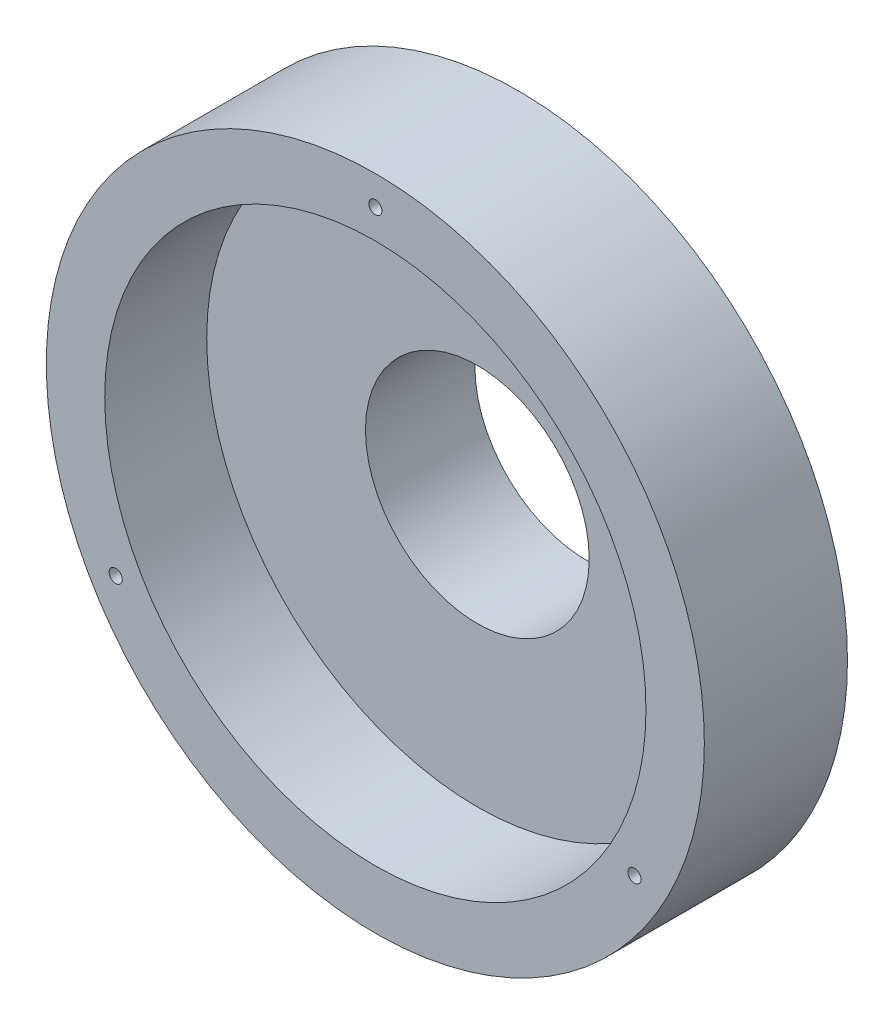
from build123d import *

# Parameters (mm, degrees)
SKETCH1_R                 = 24
BOSS_EXTRUDE1_DEPTH       = 3.8
SKETCH2_R                 = 18.7
BOSS_EXTRUDE2_DEPTH       = 4.5
SKETCH3_R                 = 1
CUT_EXTRUDE1_DEPTH        = 4.5
SKETCH4_R                 = 13.6
CUT_EXTRUDE2_DEPTH        = 35.941236383
SKETCH5_R                 = 40
BOSS_EXTRUDE3_DEPTH       = 17.4
SKETCH6_R                 = 32.9
CUT_EXTRUDE6_DEPTH        = 12.4
CUT_EXTRUDE7_START        = -12.4
SKETCH7_R                 = 13.6
CUT_EXTRUDE7_DEPTH        = 12.4
M2X0_4_TAPPED_HOLE1_D     = 1.6
M2X0_4_TAPPED_HOLE1_DEPTH = 5
M2X0_4_TAPPED_HOLE1_TIP   = 0.480688495


with BuildPart() as part:
    # Sketch1 → Boss-Extrude1 (new body)
    with BuildSketch(Plane.XY):
        Circle(SKETCH1_R)
    extrude(amount=BOSS_EXTRUDE1_DEPTH)

    # Sketch2 → Boss-Extrude2 (add)
    with BuildSketch(Plane.XY.offset(3.8)):
        Circle(SKETCH2_R)
    extrude(amount=BOSS_EXTRUDE2_DEPTH)

    # Sketch3 → Cut-Extrude1 (cut)
    with BuildSketch(Plane.XY.offset(3.8)):
        with Locations((0, 22.2)):
            Circle(SKETCH3_R)
    extrude(amount=-CUT_EXTRUDE1_DEPTH, mode=Mode.SUBTRACT)

    # Sketch4 → Cut-Extrude2 (cut, through all)
    with BuildSketch(Plane.XY.offset(8.3)):
        Circle(SKETCH4_R)
    extrude(amount=-CUT_EXTRUDE2_DEPTH, mode=Mode.SUBTRACT)

    # Sketch5 → Boss-Extrude3 (add)
    with BuildSketch(Plane.XY.offset(8.3)):
        Circle(SKETCH5_R)
    extrude(amount=BOSS_EXTRUDE3_DEPTH)

    # Sketch6 → Cut-Extrude6 (cut)
    with BuildSketch(Plane.XY.offset(25.7)):
        Circle(SKETCH6_R)
    extrude(amount=-CUT_EXTRUDE6_DEPTH, mode=Mode.SUBTRACT)

    # Sketch7 → Cut-Extrude7 (cut)
    with BuildSketch(Plane(origin=(0, 0, 8.3), x_dir=(-1, 0, 0), z_dir=(0, 0, -1)).offset(CUT_EXTRUDE7_START)):
        Circle(SKETCH7_R)
    extrude(amount=CUT_EXTRUDE7_DEPTH, mode=Mode.SUBTRACT)

    # M2x0.4 Tapped Hole1
    with Locations(Plane(origin=(0, 36.45, 25.7), x_dir=(1, 0, 0), z_dir=(0, 0, 1))):
        with Locations((0, 0), (-31.566625968, -54.6), (31.501674063, -54.6375)):
            Hole(M2X0_4_TAPPED_HOLE1_D / 2, depth=M2X0_4_TAPPED_HOLE1_DEPTH)
            with Locations((0, 0, -(M2X0_4_TAPPED_HOLE1_DEPTH + M2X0_4_TAPPED_HOLE1_TIP / 2))):  # 118° drill point
                Cone(0, M2X0_4_TAPPED_HOLE1_D / 2, M2X0_4_TAPPED_HOLE1_TIP, mode=Mode.SUBTRACT)


solid = part.part
